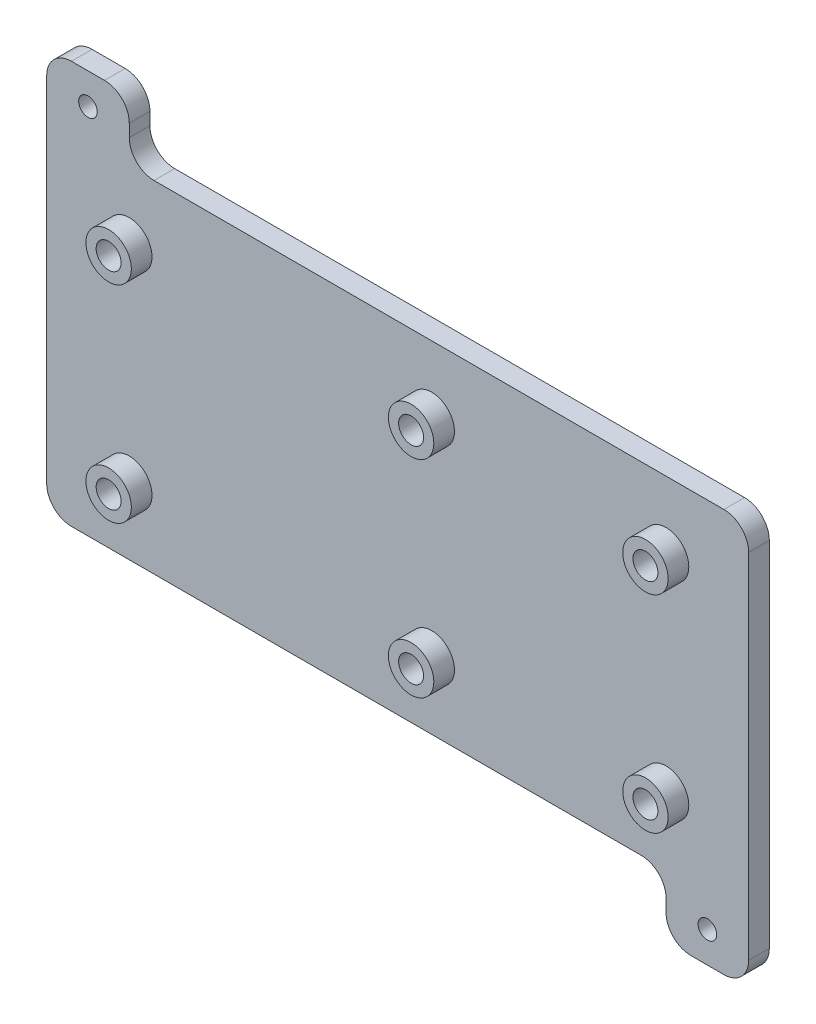
from build123d import *

# Parameters (mm, degrees)
SKETCH1_W            = 170
SKETCH1_H            = 82.55
BOSS_EXTRUDE1_DEPTH  = 5
SKETCH2_R            = 5.5
SKETCH2_R_2          = 3.025
BOSS_EXTRUDE2_DEPTH  = 5
SKETCH3_W            = 20
SKETCH3_H            = 15
BOSS_EXTRUDE3_DEPTH  = 5
FILLET1_R            = 6
M4_CLEARANCE_HOLE1_D = 4.5


with BuildPart() as part:
    # Sketch1 → Boss-Extrude1 (new body)
    with BuildSketch(Plane.XY):
        Rectangle(SKETCH1_W, SKETCH1_H)
    extrude(amount=BOSS_EXTRUDE1_DEPTH)

    # Sketch2 → Boss-Extrude2 (add)
    # profile 1 of 6: a face of its own
    with BuildSketch(Plane.XY.offset(5)):
        with Locations((65, 25)):
            Circle(SKETCH2_R)
        with Locations((65, 25)):
            Circle(SKETCH2_R_2, mode=Mode.SUBTRACT)
    # profile 2 of 6: a face of its own
    with BuildSketch(Plane.XY.offset(5)):
        with Locations((8.25, 25)):
            Circle(SKETCH2_R)
        with Locations((8.25, 25)):
            Circle(SKETCH2_R_2, mode=Mode.SUBTRACT)
    # profile 3 of 6: a face of its own
    with BuildSketch(Plane.XY.offset(5)):
        with Locations((-65, 25)):
            Circle(SKETCH2_R)
        with Locations((-65, 25)):
            Circle(SKETCH2_R_2, mode=Mode.SUBTRACT)
    # profile 4 of 6: a face of its own
    with BuildSketch(Plane.XY.offset(5)):
        with Locations((-65, -25)):
            Circle(SKETCH2_R)
        with Locations((-65, -25)):
            Circle(SKETCH2_R_2, mode=Mode.SUBTRACT)
    # profile 5 of 6: a face of its own
    with BuildSketch(Plane.XY.offset(5)):
        with Locations((8.25, -25)):
            Circle(SKETCH2_R)
        with Locations((8.25, -25)):
            Circle(SKETCH2_R_2, mode=Mode.SUBTRACT)
    # profile 6 of 6: a face of its own
    with BuildSketch(Plane.XY.offset(5)):
        with Locations((65, -25)):
            Circle(SKETCH2_R)
        with Locations((65, -25)):
            Circle(SKETCH2_R_2, mode=Mode.SUBTRACT)
    extrude(amount=BOSS_EXTRUDE2_DEPTH)

    # Sketch3 → Boss-Extrude3 (add)
    with BuildSketch(Plane.XY.offset(5)):
        with Locations((75, -48.775)):
            Rectangle(SKETCH3_W, SKETCH3_H)
        with Locations((-75, 48.775)):
            Rectangle(SKETCH3_W, SKETCH3_H)
    extrude(amount=-BOSS_EXTRUDE3_DEPTH)

    # Fillet1
    fillet1_edges = [part.edges().sort_by_distance(p)[0] for p in [
        (65, -41.275, 2.5),
        (65, -56.275, 2.5),
        (85, -56.275, 2.5),
        (85, 41.275, 2.5),
        (-65, 41.275, 2.5),
        (-65, 56.275, 2.5),
        (-85, 56.275, 2.5),
        (-85, -41.275, 2.5),
    ]]
    fillet(fillet1_edges, radius=FILLET1_R)

    # M4 Clearance Hole1 (through all)
    with Locations(Plane.XY.offset(5)):
        with Locations((-75, 48.775), (75, -48.775)):
            Hole(M4_CLEARANCE_HOLE1_D / 2)


solid = part.part
